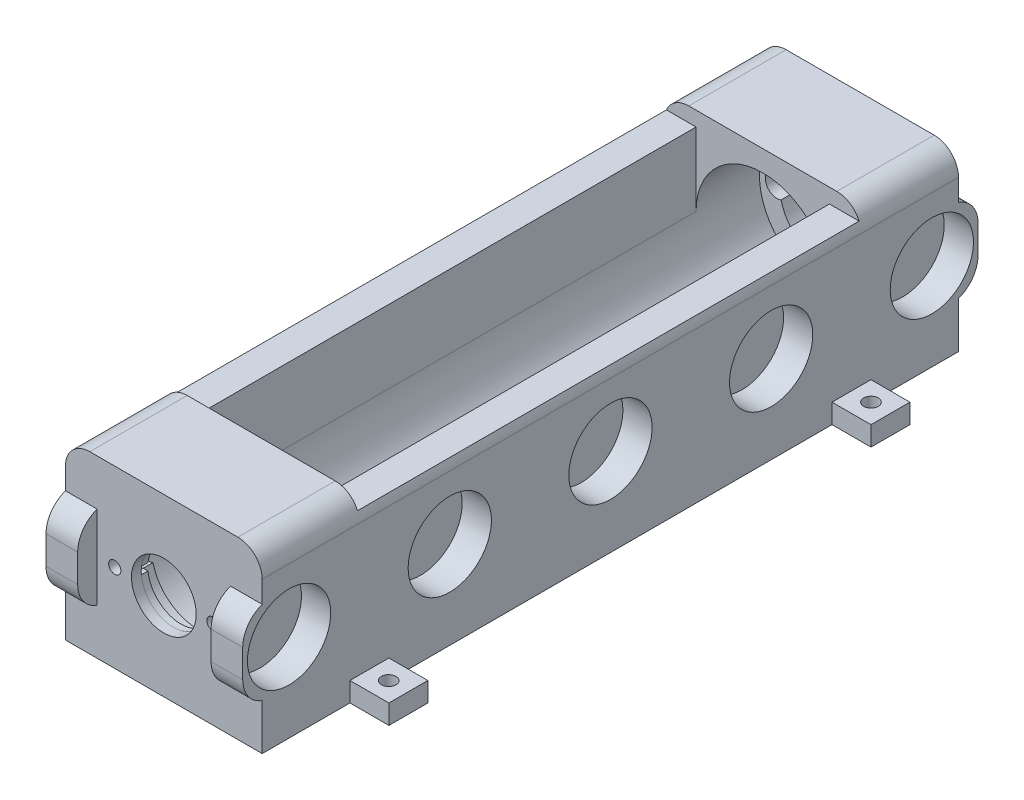
from build123d import *

# Parameters (mm, degrees)
CROQUIS1_R              = 13.7
SALIENTE_EXTRUIR1_DEPTH = 5
CROQUIS2_R              = 9.5
CORTAR_EXTRUIR1_DEPTH   = 3.5
CROQUIS3_R              = 6.8
CORTAR_EXTRUIR2_DEPTH   = 3
SALIENTE_EXTRUIR2_START = 2
CROQUIS4_R              = 13.7
CROQUIS4_R_2            = 6.65
SALIENTE_EXTRUIR2_DEPTH = 2
CROQUIS5_R              = 1.25
CORTAR_EXTRUIR3_DEPTH   = 21.600485431
CROQUIS6_W              = 40.4
CROQUIS6_H              = 36
CROQUIS6_R              = 13.7
SALIENTE_EXTRUIR3_DEPTH = 20
CROQUIS8_W              = 6.5
CROQUIS8_H              = 15
SALIENTE_EXTRUIR5_DEPTH = 51.5
CROQUIS11_W             = 6.5
CROQUIS11_H             = 17.1
SALIENTE_EXTRUIR6_DEPTH = 4
CROQUIS9_R              = 8.55
CORTAR_EXTRUIR4_DEPTH   = 6
REDONDEO1_R             = 5
REDONDEO2_R             = 5
CROQUIS10_R             = 4
CORTAR_EXTRUIR5_DEPTH   = 16
CROQUIS12_R             = 2
CORTAR_EXTRUIR6_DEPTH   = 24
REDONDEO4_R             = 6
REDONDEO5_R             = 6
CROQUIS13_W             = 8
CROQUIS13_H             = 4
SALIENTE_EXTRUIR7_DEPTH = 8
CROQUIS14_R             = 1.5
CORTAR_EXTRUIR7_DEPTH   = 8


with BuildPart() as part:
    # Croquis1 → Saliente-Extruir1 (new body)
    with BuildSketch(Plane.XY):
        Circle(CROQUIS1_R)
        with BuildLine():
            Line((0, 0.75), (7.800197377, 0.75))
            ThreePointArc((7.800197377, 0.75), (10.459785271, 2.369760146), (12.48, 0))
            ThreePointArc((12.48, 0), (10.459785271, -2.369760146), (7.800197377, -0.75))
            Line((7.800197377, -0.75), (0, -0.75))
            Line((0, -0.75), (-7.800197377, -0.75))
            ThreePointArc((-7.800197377, -0.75), (-12.48, 0), (-7.800197377, 0.75))
            Line((-7.800197377, 0.75), (0, 0.75))
        make_face(mode=Mode.SUBTRACT)
    extrude(amount=SALIENTE_EXTRUIR1_DEPTH)

    # Croquis2 → Cortar-Extruir1 (cut)
    with BuildSketch(Plane.XY.offset(5)):
        Circle(CROQUIS2_R)
    extrude(amount=-CORTAR_EXTRUIR1_DEPTH, mode=Mode.SUBTRACT)

    # Croquis3 → Cortar-Extruir2 (cut)
    with BuildSketch(Plane.XY.offset(1.5)):
        Circle(CROQUIS3_R)
    extrude(amount=-CORTAR_EXTRUIR2_DEPTH, mode=Mode.SUBTRACT)

    # Croquis4 → Saliente-Extruir2 (add)
    with BuildSketch(Plane(origin=(0, 0, 0), x_dir=(-1, 0, 0), z_dir=(0, 0, -1)).offset(SALIENTE_EXTRUIR2_START)):
        Circle(CROQUIS4_R)
        Circle(CROQUIS4_R_2, mode=Mode.SUBTRACT)
    extrude(amount=-SALIENTE_EXTRUIR2_DEPTH)

    # Croquis5 → Cortar-Extruir3 (cut, through all)
    with BuildSketch(Plane.XY.offset(5)):
        with Locations((-10.08, 0)):
            Circle(CROQUIS5_R)
        with Locations((10.08, 0)):
            Circle(CROQUIS5_R)
    extrude(amount=-CORTAR_EXTRUIR3_DEPTH, mode=Mode.SUBTRACT)



with BuildPart() as body_2:
    # Croquis6 → Saliente-Extruir3 (new body)
    with BuildSketch(Plane(origin=(0, 0, -2), x_dir=(-1, 0, 0), z_dir=(0, 0, -1))):
        Rectangle(CROQUIS6_W, CROQUIS6_H)
        Circle(CROQUIS6_R, mode=Mode.SUBTRACT)
    extrude(amount=-SALIENTE_EXTRUIR3_DEPTH)

    # Croquis8 → Saliente-Extruir5 (add)
    with BuildSketch(Plane.XY.offset(18)):
        with BuildLine():
            ThreePointArc((13.7, 0), (0, -13.7), (-13.7, 0))
            Line((-13.7, 0), (-20.2, 0))
            Line((-20.2, 0), (-20.2, -18))
            Line((-20.2, -18), (20.2, -18))
            Line((20.2, -18), (20.2, 0))
            Line((20.2, 0), (13.7, 0))
        make_face()
        with Locations((-16.95, 7.5)):
            Rectangle(CROQUIS8_W, CROQUIS8_H)
        with Locations((16.95, 7.5)):
            Rectangle(CROQUIS8_W, CROQUIS8_H)
    extrude(amount=SALIENTE_EXTRUIR5_DEPTH)


with BuildPart() as part_1:
    add(part.part)

    add(body_2.part)  # Saliente-Extruir6 merges body 2
    # Croquis11 → Saliente-Extruir6 (add)
    with BuildSketch(Plane(origin=(0, 0, -2), x_dir=(-1, 0, 0), z_dir=(0, 0, -1))):
        with Locations((-16.95, 0)):
            Rectangle(CROQUIS11_W, CROQUIS11_H)
        with Locations((16.95, 0)):
            Rectangle(CROQUIS11_W, CROQUIS11_H)
    extrude(amount=SALIENTE_EXTRUIR6_DEPTH)


with BuildPart() as body_2_2:
    # Simetría10: mirrored copy
    add(part_1.part.mirror(Plane.XY.offset(69.5)))


with BuildPart() as cortar_extruir4_tool:
    # Croquis9 → Cortar-Extruir4 (new body)
    with BuildSketch(Plane.ZY.offset(20.2)):
        with Locations((3.479126344, 0)):
            Circle(CROQUIS9_R)
        with Locations((36.479126344, 0)):
            Circle(CROQUIS9_R)
        with Locations((69.479126344, 0)):
            Circle(CROQUIS9_R)
        with Locations((102.479126344, 0)):
            Circle(CROQUIS9_R)
        with Locations((135.479126344, 0)):
            Circle(CROQUIS9_R)
    cortar_extruir4 = extrude(amount=-CORTAR_EXTRUIR4_DEPTH)


with BuildPart() as part_2:
    add(part_1.part)

    # Cortar-Extruir4: cut by cortar_extruir4_tool
    add(cortar_extruir4_tool.part, mode=Mode.SUBTRACT)


with BuildPart() as body_2_2_1:
    add(body_2_2.part)

    # Cortar-Extruir4: cut by cortar_extruir4_tool
    add(cortar_extruir4_tool.part, mode=Mode.SUBTRACT)


with BuildPart() as simetr_a11_tool:
    # Simetría11: Cortar-Extruir4 across plane
    add(cortar_extruir4.mirror(Plane(origin=(0, 0, 0), x_dir=(0, 0, 1), z_dir=(1, 0, 0))))


with BuildPart() as part_3:
    add(part_2.part)

    # Simetría11: cut by simetr_a11_tool
    add(simetr_a11_tool.part, mode=Mode.SUBTRACT)

    # Redondeo1
    redondeo1_edges = [part_3.edges().sort_by_distance(p)[0] for p in [
        (20.2, 18, 8),
        (-20.2, 18, 8),
    ]]
    fillet(redondeo1_edges, radius=REDONDEO1_R)


with BuildPart() as body_2_2_2:
    add(body_2_2_1.part)

    # Simetría11: cut by simetr_a11_tool
    add(simetr_a11_tool.part, mode=Mode.SUBTRACT)

    # Redondeo2
    redondeo2_edges = [body_2_2_2.edges().sort_by_distance(p)[0] for p in [
        (20.2, 18, 131),
        (-20.2, 18, 131),
    ]]
    fillet(redondeo2_edges, radius=REDONDEO2_R)


with BuildPart() as cortar_extruir5_tool:
    # Croquis10 → Cortar-Extruir5 (new body)
    with BuildSketch(Plane.XZ):
        with Locations(Location((0, 60, 0), (0, 0, 90))):
            Circle(CROQUIS10_R)
        with Locations(Location((0, 105, 0), (0, 0, 90))):
            Circle(CROQUIS10_R)
        with Locations(Location((0, 80, 0), (0, 0, 90))):
            Circle(CROQUIS10_R)
        with Locations(Location((0, 25, 0), (0, 0, 90))):
            Circle(CROQUIS10_R)
    extrude(amount=CORTAR_EXTRUIR5_DEPTH)


with BuildPart() as part_4:
    add(part_3.part)

    # Cortar-Extruir5: cut by cortar_extruir5_tool
    add(cortar_extruir5_tool.part, mode=Mode.SUBTRACT)


with BuildPart() as body_2_2_3:
    add(body_2_2_2.part)

    # Cortar-Extruir5: cut by cortar_extruir5_tool
    add(cortar_extruir5_tool.part, mode=Mode.SUBTRACT)


with BuildPart() as cortar_extruir6_tool:
    # Croquis12 → Cortar-Extruir6 (new body)
    with BuildSketch(Plane.XZ):
        with Locations(Location((0, 60, 0), (0, 0, 270))):
            Circle(CROQUIS12_R)
        with Locations(Location((0, 105, 0), (0, 0, 270))):
            Circle(CROQUIS12_R)
        with Locations(Location((0, 80, 0), (0, 0, 270))):
            Circle(CROQUIS12_R)
        with Locations(Location((0, 25, 0), (0, 0, 270))):
            Circle(CROQUIS12_R)
    extrude(amount=CORTAR_EXTRUIR6_DEPTH)


with BuildPart() as part_5:
    add(part_4.part)

    # Cortar-Extruir6: cut by cortar_extruir6_tool
    add(cortar_extruir6_tool.part, mode=Mode.SUBTRACT)

    # Redondeo5
    # the kernel refuses this fillet: 6 mm, written as the material it takes off along each edge
    with BuildSketch(Plane(origin=(-34.342135624, -8.55, -6), x_dir=(0, 0, 1), z_dir=(1, 0, 0)), Plane(origin=(0.442135624, 8.55, -6), x_dir=(0, 0, 1), z_dir=(-1, 0, 0)), Plane(origin=(34.342135624, 8.55, -6), x_dir=(0, 0, 1), z_dir=(-1, 0, 0))) as redondeo5_piece_1:
        with BuildLine():
            CenterArc((6, -5.656854249), REDONDEO5_R, 109.471220634, 70.528779366)
            Line((0, -5.656854249), (-0.12, -5.656854249))
            Line((-0.12, -5.656854249), (-0.12, 0))
            Line((-0.12, 0), (0, 0.12))
            ThreePointArc((0, 0.12), (2, 0.12), (3.96, 0.113137085))
            Line((3.96, 0.113137085), (4, 0))
        make_face()
    extrude(amount=34.784271247, mode=Mode.SUBTRACT)
    with BuildSketch(Plane(origin=(-0.442135624, -8.55, -6), x_dir=(0, 1, 0), z_dir=(1, 0, 0))) as redondeo5_piece_2:
        with BuildLine():
            CenterArc((5.656854249, 6), REDONDEO5_R, 199.471220634, 70.528779366)
            Line((0, 4), (-0.113137085, 3.96))
            ThreePointArc((-0.113137085, 3.96), (-0.12, 2), (-0.12, 0))
            Line((-0.12, 0), (0, -0.12))
            Line((0, -0.12), (5.656854249, -0.12))
            Line((5.656854249, -0.12), (5.656854249, 0))
        make_face()
    extrude(amount=34.784271247, mode=Mode.SUBTRACT)



with BuildPart() as body_2_2_4:
    add(body_2_2_3.part)

    # Cortar-Extruir6: cut by cortar_extruir6_tool
    add(cortar_extruir6_tool.part, mode=Mode.SUBTRACT)

    # Redondeo4
    # the kernel refuses this fillet: 6 mm, written as the material it takes off along each edge
    with BuildSketch(Plane(origin=(-34.342135624, -8.55, 145), x_dir=(0, 0, -1), z_dir=(1, 0, 0)), Plane(origin=(0.442135624, 8.55, 145), x_dir=(0, 0, -1), z_dir=(-1, 0, 0)), Plane(origin=(-0.442135624, -8.55, 145), x_dir=(0, 0, -1), z_dir=(1, 0, 0)), Plane(origin=(34.342135624, 8.55, 145), x_dir=(0, 0, -1), z_dir=(-1, 0, 0))) as redondeo4_piece_1:
        with BuildLine():
            CenterArc((6, 5.656854249), REDONDEO4_R, 180, 70.528779366)
            Line((0, 5.656854249), (-0.12, 5.656854249))
            Line((-0.12, 5.656854249), (-0.12, 0))
            Line((-0.12, 0), (0, -0.12))
            ThreePointArc((0, -0.12), (2, -0.12), (3.96, -0.113137085))
            Line((3.96, -0.113137085), (4, 0))
        make_face()
    extrude(amount=34.784271247, mode=Mode.SUBTRACT)


with BuildPart() as part_6:
    add(part_5.part)

    add(body_2_2_4.part)  # Saliente-Extruir7 merges body 2 2
    # Croquis13 → Saliente-Extruir7 (add)
    with BuildSketch(Plane.ZY.offset(20.2)):
        with Locations((19.979126344, -16)):
            Rectangle(CROQUIS13_W, CROQUIS13_H)
        with Locations((118.979126344, -16)):
            Rectangle(CROQUIS13_W, CROQUIS13_H)
    saliente_extruir7 = extrude(amount=SALIENTE_EXTRUIR7_DEPTH)

    # Croquis14 → Cortar-Extruir7 (cut)
    with BuildSketch(Plane(origin=(0, -14, 0), x_dir=(1, 0, 0), z_dir=(0, 1, 0))):
        with Locations(Location((-24.2, -19.979126344, 0), (0, 0, 270))):
            Circle(CROQUIS14_R)
        with Locations(Location((-24.2, -119.020873656, 0), (0, 0, 90))):
            Circle(CROQUIS14_R)
    cortar_extruir7 = extrude(amount=-CORTAR_EXTRUIR7_DEPTH, mode=Mode.SUBTRACT)

    # Simetría12: Saliente-Extruir7, Cortar-Extruir7 across plane
    add(saliente_extruir7.mirror(Plane(origin=(0, 0, 0), x_dir=(0, 0, 1), z_dir=(1, 0, 0))))
    add(cortar_extruir7.mirror(Plane(origin=(0, 0, 0), x_dir=(0, 0, 1), z_dir=(1, 0, 0))), mode=Mode.SUBTRACT)


solid = part_6.part
